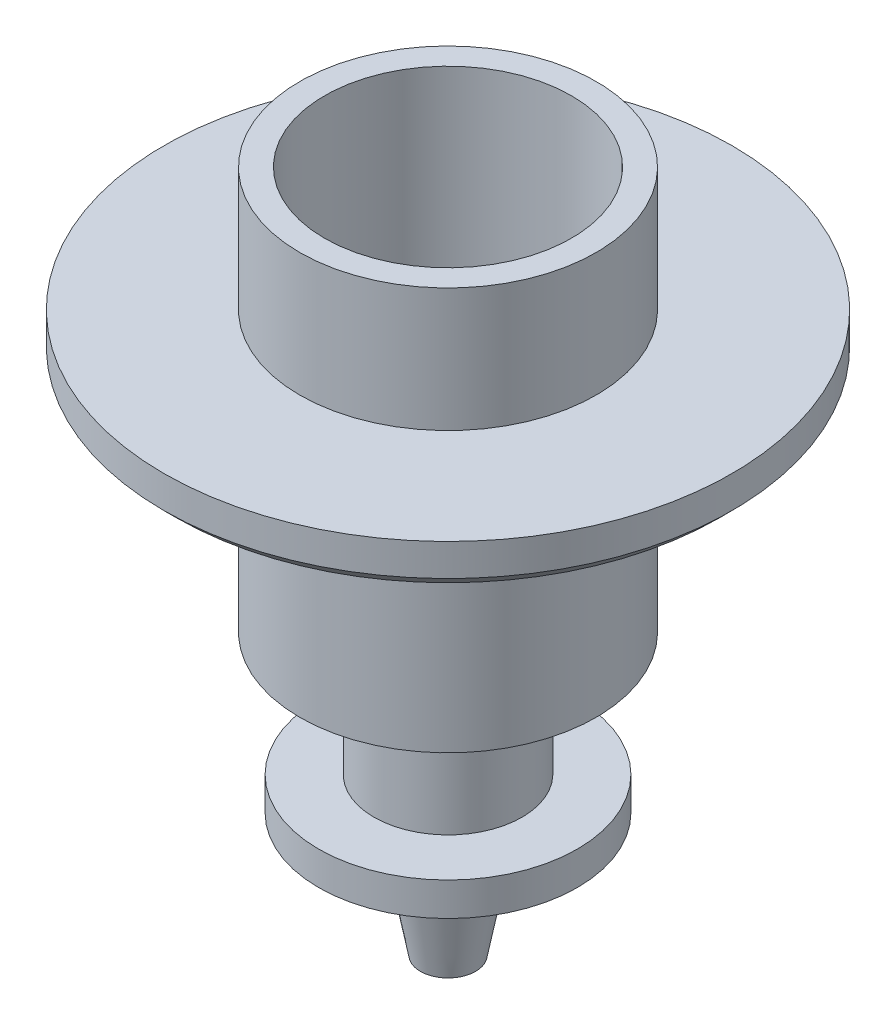
from build123d import *

# Parameters (mm, degrees)
SKETCH2_R          = 0.3
CUT_EXTRUDE1_DEPTH = 17.038105375
SKETCH2_3_R        = 2.5
SKETCH2_3_R_2      = 0.3
CUT_EXTRUDE2_DEPTH = 7.5


with BuildPart() as part:
    # Sketch1 → Revolve1 (revolve)
    with BuildSketch(Plane.XY):
        Polygon((-3, 11.528571429), (-3, 9.028571429), (-5.75, 9.028571429), (-5.75, 8.378571429), (-5.5, 8.128571429), (-3, 8.128571429), (-3, 3.378571429), (-1.62626129, 2.878571429), (-1.5, 2.878571429), (-1.5, 0.878571429), (-2.618482429, 0.878571429), (-2.618482429, 0.203307318), (-1.03161177, 0.203307318), (-0.558926893, -2.29516989), (0, -2.29516989), (0, 11.528571429), align=None)
    revolve(axis=Axis((0, 11.528571429, 0), (0, -1, 0)))

    # Sketch2 → Cut-Extrude1 (cut, through all)
    with BuildSketch(Plane(origin=(0, 11.528571429, 0), x_dir=(1, 0, 0), z_dir=(0, 1, 0))):
        Circle(SKETCH2_R)
    extrude(amount=-CUT_EXTRUDE1_DEPTH, mode=Mode.SUBTRACT)

    # Sketch2<3> → Cut-Extrude2 (cut)
    with BuildSketch(Plane(origin=(0, 11.528571429, 0), x_dir=(1, 0, 0), z_dir=(0, 1, 0))):
        Circle(SKETCH2_3_R)
        Circle(SKETCH2_3_R_2, mode=Mode.SUBTRACT)
    extrude(amount=-CUT_EXTRUDE2_DEPTH, mode=Mode.SUBTRACT)


solid = part.part
